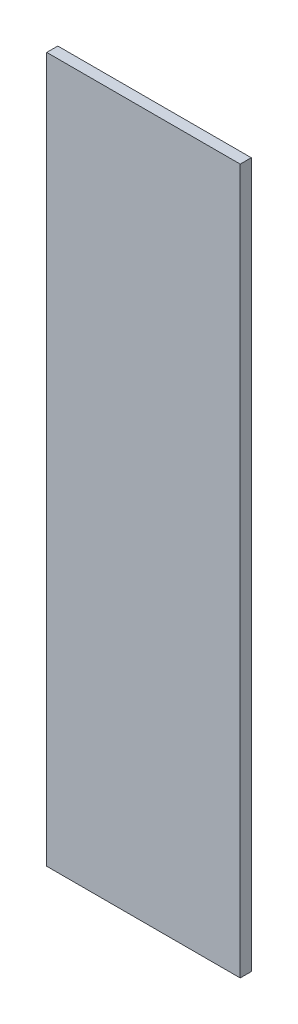
from build123d import *

# Parameters (mm, degrees)
SKETCH1_W           = 28
SKETCH1_H           = 102
BOSS_EXTRUDE1_DEPTH = 1.6


with BuildPart() as part:
    # Sketch1 → Boss-Extrude1 (new body)
    with BuildSketch(Plane.XY):
        with Locations((0, 51)):
            Rectangle(SKETCH1_W, SKETCH1_H)
    extrude(amount=BOSS_EXTRUDE1_DEPTH)


solid = part.part
